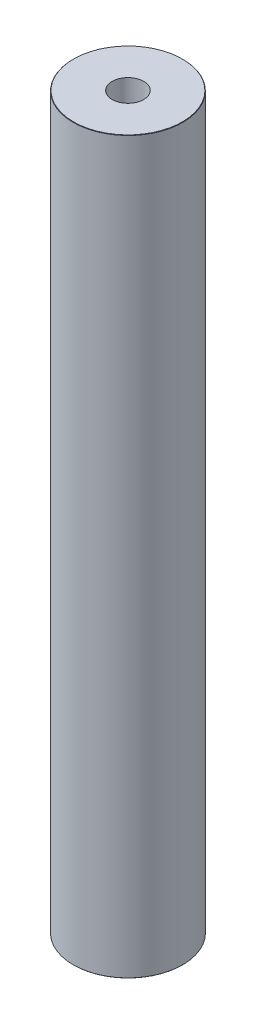
from build123d import *

# Parameters (mm, degrees)
SKETCH1_R           = 45
BOSS_EXTRUDE1_DEPTH = 600
SKETCH2_R           = 12.966267456
CUT_EXTRUDE1_DEPTH  = 604.365560834
CHAMFER1_SIZE       = 0.271270824


with BuildPart() as part:
    # Sketch1 → Boss-Extrude1 (new body)
    with BuildSketch(Plane(origin=(0, 0, 0), x_dir=(1, 0, 0), z_dir=(0, 1, 0))):
        Circle(SKETCH1_R)
    extrude(amount=BOSS_EXTRUDE1_DEPTH)

    # Sketch2 → Cut-Extrude1 (cut, through all)
    with BuildSketch(Plane(origin=(0, 0, 0), x_dir=(1, 0, 0), z_dir=(0, 1, 0))):
        Circle(SKETCH2_R)
    extrude(amount=CUT_EXTRUDE1_DEPTH, mode=Mode.SUBTRACT)

    # Chamfer1
    chamfer1_edges = [part.edges().sort_by_distance(p)[0] for p in [
        (-45, 600, 0),
        (-45, 0, 0),
    ]]
    chamfer(chamfer1_edges, length=CHAMFER1_SIZE)


solid = part.part
